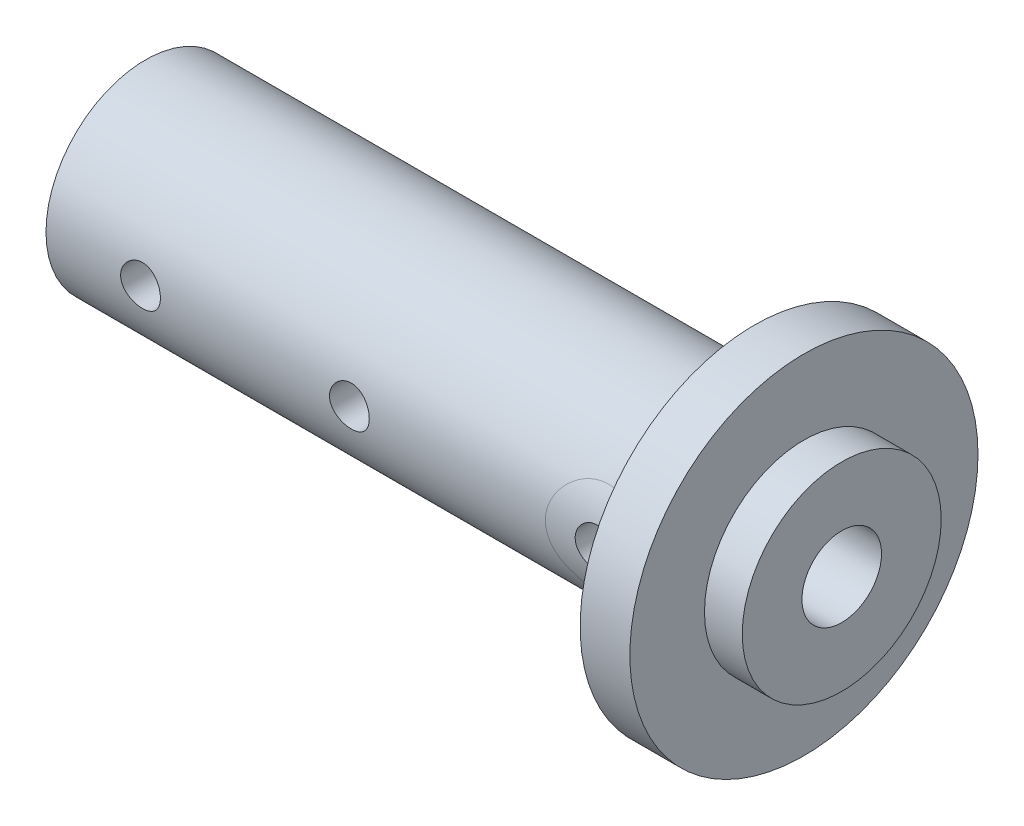
from build123d import *

# Parameters (mm, degrees)
CUT_EXTRUDE2_DEPTH      = 75.246212025
CUT_EXTRUDE2_DEPTH_BACK = 75.246212025
SKETCH5_R               = 2


with BuildPart() as part:
    # Sketch1 → Revolve2 (revolve)
    with BuildSketch(Plane(origin=(0, 0, 0), x_dir=(1, 0, 0), z_dir=(0, 1, 0))):
        Polygon((-3.8, 10), (-3.8, 17.5), (-8.8, 17.5), (-8.8, 10), (-70, 10), (-70, 0), (-19, 0), (-19, 4), (0, 4), (0, 10), align=None)
    revolve(axis=Axis((0, 0, 0), (-1, 0, 0)))

    # Sketch5 → Cut-Extrude2 (cut, two sides: drawn at the far end of the back side and taken through both)
    with BuildSketch(Plane.XY.offset(-CUT_EXTRUDE2_DEPTH_BACK)):
        with Locations((-39.5, 0)):
            Circle(SKETCH5_R)
        with Locations((-60.5, 0)):
            Circle(SKETCH5_R)
        with Locations((-14.8, 0)):
            Circle(SKETCH5_R)
    extrude(amount=CUT_EXTRUDE2_DEPTH + CUT_EXTRUDE2_DEPTH_BACK, mode=Mode.SUBTRACT)


solid = part.part
